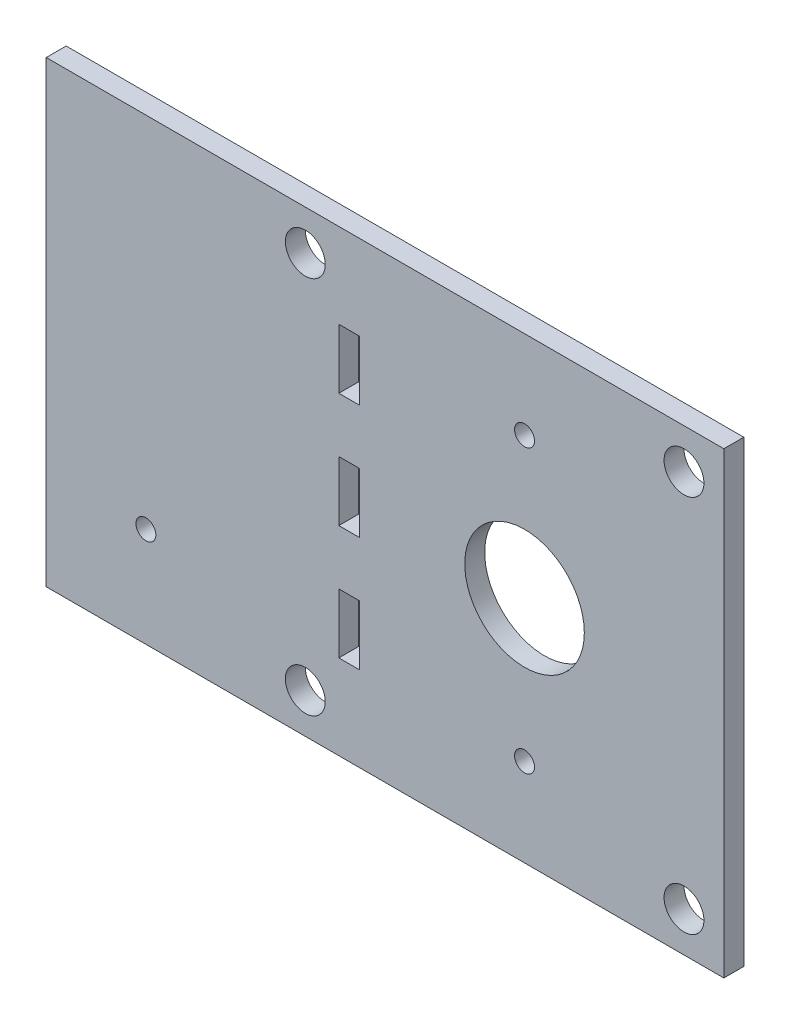
from build123d import *

# Parameters (mm, degrees)
SKETCH1_W           = 215.9
SKETCH1_H           = 146.05
SKETCH1_R           = 6.35
SKETCH1_R_2         = 19.05
SKETCH1_R_3         = 3.175
SKETCH1_W_2         = 6.604
SKETCH1_H_2         = 19.05
BOSS_EXTRUDE1_DEPTH = 3.175
SKETCH2_R           = 3.175
CUT_EXTRUDE1_DEPTH  = 170.111599617


with BuildPart() as part:
    # Sketch1 → Boss-Extrude1 (new, symmetric)
    with BuildSketch(Plane.XY):
        with Locations((-44.45, 0)):
            Rectangle(SKETCH1_W, SKETCH1_H)
        with Locations((50.8, 60.325)):
            Circle(SKETCH1_R, mode=Mode.SUBTRACT)
        with Locations((50.8, -60.325)):
            Circle(SKETCH1_R, mode=Mode.SUBTRACT)
        Circle(SKETCH1_R_2, mode=Mode.SUBTRACT)
        with Locations((0, 45)):
            Circle(SKETCH1_R_3, mode=Mode.SUBTRACT)
        with Locations((0, -45)):
            Circle(SKETCH1_R_3, mode=Mode.SUBTRACT)
        with Locations((-69.85, 60.325)):
            Circle(SKETCH1_R, mode=Mode.SUBTRACT)
        with Locations((-69.85, -60.325)):
            Circle(SKETCH1_R, mode=Mode.SUBTRACT)
        with Locations((-55.88, 0)):
            Rectangle(SKETCH1_W_2, SKETCH1_H_2, mode=Mode.SUBTRACT)
        with Locations((-55.88, 36.5125)):
            Rectangle(SKETCH1_W_2, SKETCH1_H_2, mode=Mode.SUBTRACT)
        with Locations((-55.88, -36.5125)):
            Rectangle(SKETCH1_W_2, SKETCH1_H_2, mode=Mode.SUBTRACT)
    extrude(amount=BOSS_EXTRUDE1_DEPTH, both=True)

    # Sketch2 → Cut-Extrude1 (cut, through all)
    with BuildSketch(Plane.XY.offset(3.175)):
        with Locations((-120.65, -41.275)):
            Circle(SKETCH2_R)
    extrude(amount=-CUT_EXTRUDE1_DEPTH, mode=Mode.SUBTRACT)


solid = part.part
